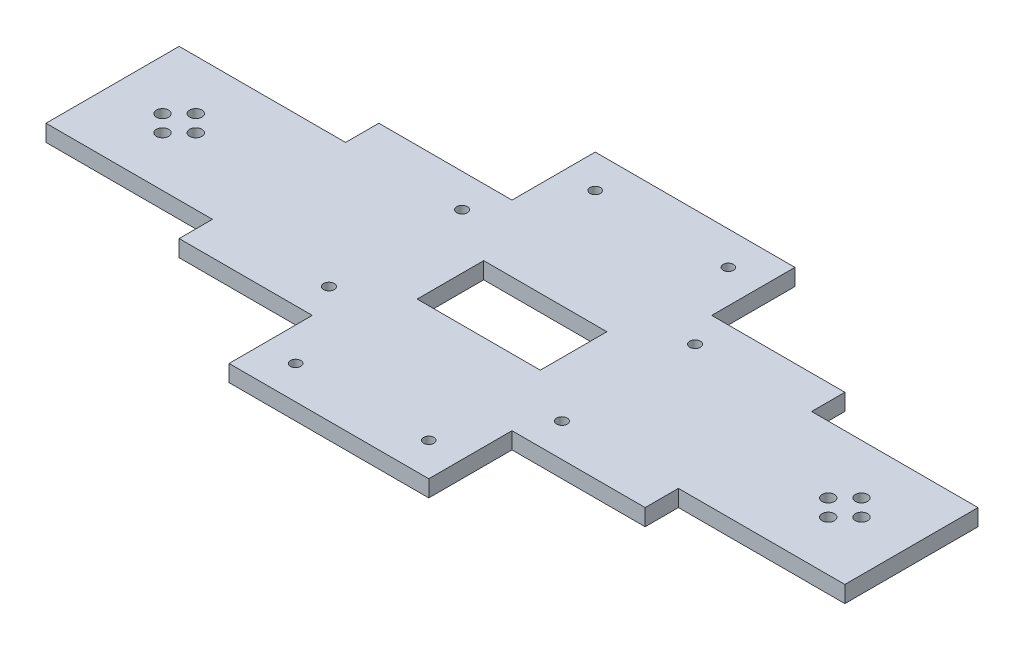
from build123d import *

# Parameters (mm, degrees)
SKETCH1_W           = 37
SKETCH1_H           = 20
SKETCH1_R           = 1.6
SKETCH1_R_2         = 1.85
BOSS_EXTRUDE1_DEPTH = 5
SKETCH2_W           = 60
SKETCH2_H           = 25
SKETCH2_R           = 1.55
BOSS_EXTRUDE2_DEPTH = 5


with BuildPart() as part:
    # Sketch1 → Boss-Extrude1 (new body)
    with BuildSketch(Plane(origin=(0, 0, 0), x_dir=(1, 0, 0), z_dir=(0, 1, 0))):
        Polygon((-70, 30), (-70, 20), (-120, 20), (-120, -20), (-70, -20), (-70, -30), (70, -30), (70, -20), (120, -20), (120, 20), (70, 20), (70, 30), align=None)
        Rectangle(SKETCH1_W, SKETCH1_H, mode=Mode.SUBTRACT)
        with Locations((-35, -20)):
            Circle(SKETCH1_R, mode=Mode.SUBTRACT)
        with Locations((-35, 20)):
            Circle(SKETCH1_R, mode=Mode.SUBTRACT)
        with Locations((35, -20)):
            Circle(SKETCH1_R, mode=Mode.SUBTRACT)
        with Locations((35, 20)):
            Circle(SKETCH1_R, mode=Mode.SUBTRACT)
        with Locations((-100, 5)):
            Circle(SKETCH1_R_2, mode=Mode.SUBTRACT)
        with Locations((-100, -5)):
            Circle(SKETCH1_R_2, mode=Mode.SUBTRACT)
        with Locations((-105, 0)):
            Circle(SKETCH1_R_2, mode=Mode.SUBTRACT)
        with Locations((-95, 0)):
            Circle(SKETCH1_R_2, mode=Mode.SUBTRACT)
        with Locations((100, 5)):
            Circle(SKETCH1_R_2, mode=Mode.SUBTRACT)
        with Locations((100, -5)):
            Circle(SKETCH1_R_2, mode=Mode.SUBTRACT)
        with Locations((95, 0)):
            Circle(SKETCH1_R_2, mode=Mode.SUBTRACT)
        with Locations((105, 0)):
            Circle(SKETCH1_R_2, mode=Mode.SUBTRACT)
    extrude(amount=BOSS_EXTRUDE1_DEPTH)

    # Sketch2 → Boss-Extrude2 (add)
    # profile 1 of 2: a face of its own
    with BuildSketch(Plane(origin=(0, 5, 0), x_dir=(1, 0, 0), z_dir=(0, 1, 0))):
        with Locations((0, 42.5)):
            Rectangle(SKETCH2_W, SKETCH2_H)
        with Locations((-20, 45)):
            Circle(SKETCH2_R, mode=Mode.SUBTRACT)
        with Locations((20, 45)):
            Circle(SKETCH2_R, mode=Mode.SUBTRACT)
    # profile 2 of 2: a face of its own
    with BuildSketch(Plane(origin=(0, 5, 0), x_dir=(1, 0, 0), z_dir=(0, 1, 0))):
        with Locations((0, -42.5)):
            Rectangle(SKETCH2_W, SKETCH2_H)
        with Locations((-20, -45)):
            Circle(SKETCH2_R, mode=Mode.SUBTRACT)
        with Locations((20, -45)):
            Circle(SKETCH2_R, mode=Mode.SUBTRACT)
    extrude(amount=-BOSS_EXTRUDE2_DEPTH)


solid = part.part
